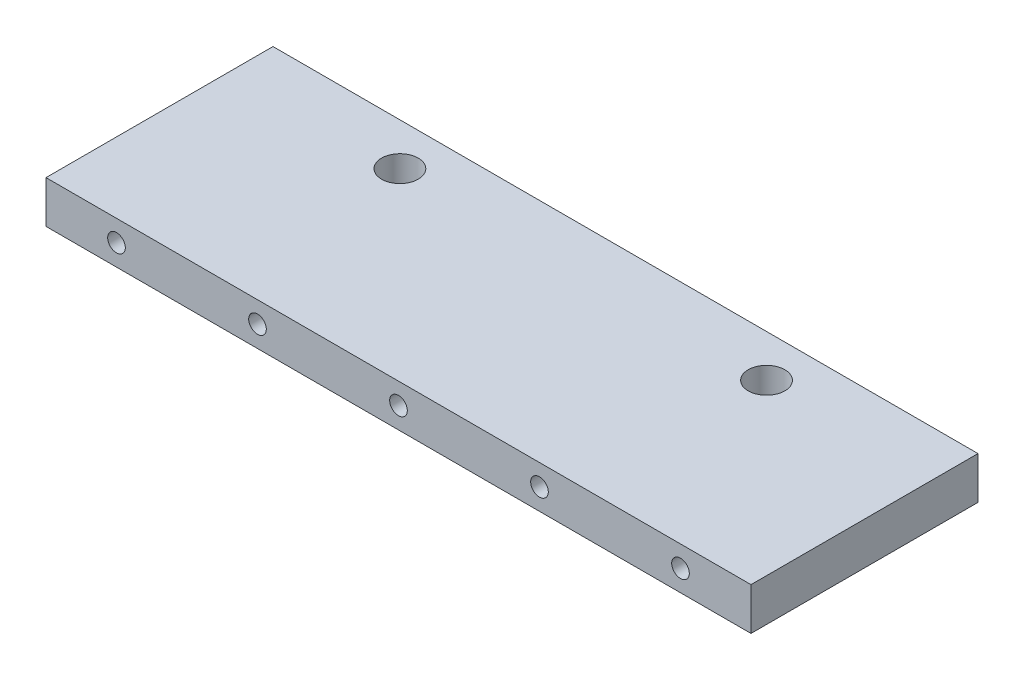
from build123d import *

# Parameters (mm, degrees)
SKETCH1_W                    = 100
SKETCH1_H                    = 32.2
BOSS_EXTRUDE1_DEPTH          = 6
TAP_DRILL_FOR_M3_TAP1_D      = 2.5
TAP_DRILL_FOR_M5_HELICOIL1_D = 5.2


with BuildPart() as part:
    # Sketch1 → Boss-Extrude1 (new body)
    with BuildSketch(Plane(origin=(0, 0, 0), x_dir=(1, 0, 0), z_dir=(0, 1, 0))):
        with Locations((50, 16.1)):
            Rectangle(SKETCH1_W, SKETCH1_H)
    extrude(amount=BOSS_EXTRUDE1_DEPTH)

    # Tap Drill for M3 Tap1 (through all)
    with Locations(Plane(origin=(0, 0, -32.2), x_dir=(-1, 0, 0), z_dir=(0, 0, -1))):
        with Locations((-90, 3), (-70, 3), (-50, 3), (-30, 3), (-10, 3)):
            Hole(TAP_DRILL_FOR_M3_TAP1_D / 2)

    # Tap Drill for M5 Helicoil1 (through all)
    with Locations(Plane(origin=(0, 6, 0), x_dir=(1, 0, 0), z_dir=(0, 1, 0))):
        with Locations((24, 26.2), (76, 26.2)):
            Hole(TAP_DRILL_FOR_M5_HELICOIL1_D / 2)


solid = part.part
